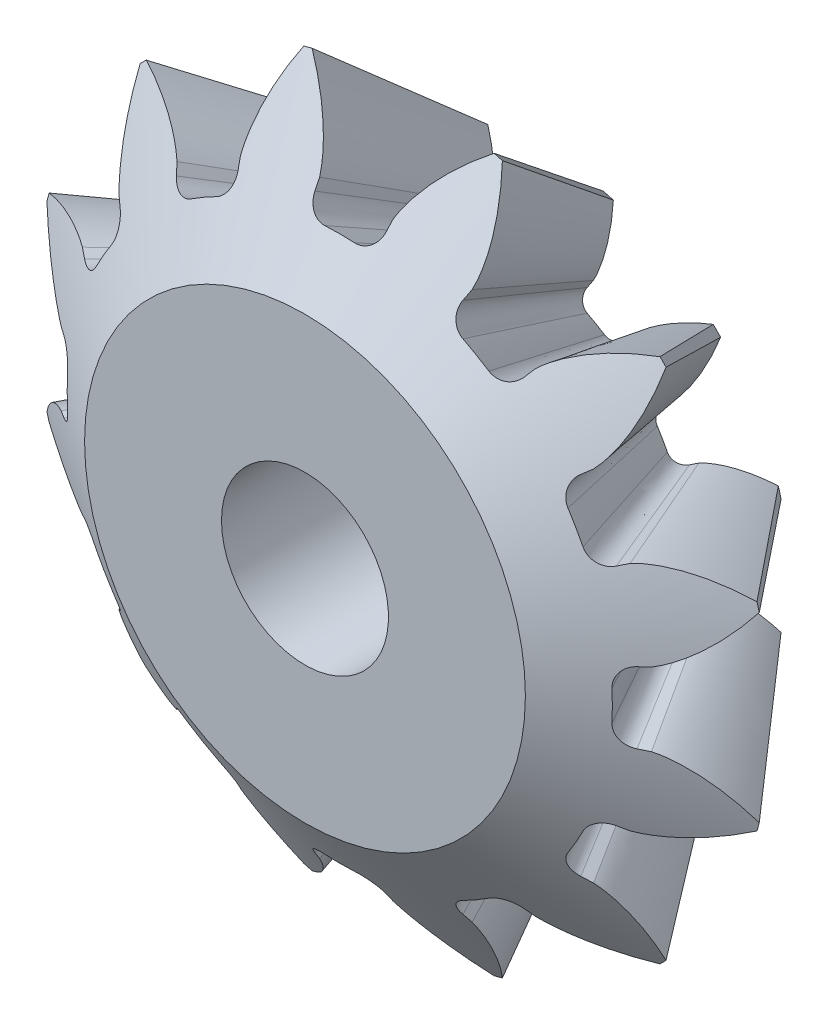
from build123d import *

# Parameters (mm, degrees)
TEETH_COUNT = 12


with BuildPart() as part:
    # Blank Sketch → Blank (revolve)
    with BuildSketch(Plane(origin=(0, 0, 0), x_dir=(1, 0, 0), z_dir=(0, 1, 0))):
        Polygon((6.213635009, -17.540922834), (11.620027042, -13.936661479), (17.611713424, -20.758857717), (10.560398314, -25.459734457), (4, -25.459734457), (4, -17.540922834), align=None)
    revolve(axis=Axis((0, 0, 0), (0, 0, 1)))

    # Heel Section Sketch for Tooth Space → Tooth Space section 0
    with BuildSketch(Plane(origin=(16.386750491, 0, 24.580125736), x_dir=(0.8320502943378437, 0, -0.5547001962252293), z_dir=(0.5547001962252291, 0, 0.8320502943378436))):
        with BuildLine():
            Line((-1.08891608, 1.922238136), (-1.634563238, 1.865864301))
            # circular arc as an exact rational Bezier (weights 1, cos(half-angle), 1)
            Bezier((-1.634563238, 1.865864301), (-2.609571063, 1.765130834), (-2.564644053, 0.785963304), weights=[1, 0.72700363, 1])
            Bezier((-2.564644053, 0.785963304), (-2.528581806, 0), (-2.564644053, -0.785963304), weights=[1, 0.998949041, 1])
            Bezier((-2.564644053, -0.785963304), (-2.609571063, -1.765130834), (-1.634563238, -1.865864301), weights=[1, 0.72700363, 1])
            Line((-1.634563238, -1.865864301), (-1.08891608, -1.922238136))
            add(Edge.make_bspline(
                [(-1.08891608, -1.922238136), (-1.058009299, -1.930081323), (-0.989704973, -1.948916589), (-0.846197794, -1.991766884), (-0.682273176, -2.051633091), (-0.464039363, -2.138079386), (-0.247151738, -2.238022431), (-0.004558905, -2.359571564), (0.226834524, -2.488356139), (0.457425198, -2.625947141), (0.681393703, -2.770305006), (0.921001726, -2.934382995), (1.208683296, -3.14547836), (1.54063082, -3.408550433), (1.911465124, -3.730523185), (2.29850424, -4.097681247), (2.670721891, -4.483299301), (3.025287202, -4.879693016), (3.367721609, -5.295465998), (3.689533802, -5.713062827), (4.005794089, -6.159094933), (4.254743772, -6.530395753), (4.48221166, -6.897435156), (4.663204857, -7.195659512), (4.830049786, -7.491940318), (4.914685936, -7.645183004), (4.971222232, -7.750335533)],
                knots=[0.016753246, 0.016753246, 0.016753246, 0.016753246, 0.016753246, 0.031570807, 0.050064154, 0.068907149, 0.096646347, 0.124385911, 0.152125765, 0.179865217, 0.207604696, 0.235344406, 0.263083989, 0.300343415, 0.355822558, 0.411301707, 0.466780802, 0.522259921, 0.577739134, 0.63321816, 0.688697367, 0.744176442, 0.799655597, 0.827395173, 0.855134749, 0.910613937, 0.910613937, 0.910613937, 0.910613937, 0.910613937], degree=4))
            Line((4.971222232, -7.750335533), (4.971222232, 7.750335533))
            add(Edge.make_bspline(
                [(-1.08891608, 1.922238136), (-1.058009299, 1.930081323), (-0.989704973, 1.948916589), (-0.846197794, 1.991766884), (-0.682273176, 2.051633091), (-0.464039363, 2.138079386), (-0.247151738, 2.238022431), (-0.004558905, 2.359571564), (0.226834524, 2.488356139), (0.457425198, 2.625947141), (0.681393703, 2.770305006), (0.921001726, 2.934382995), (1.208683296, 3.14547836), (1.54063082, 3.408550433), (1.911465124, 3.730523185), (2.29850424, 4.097681247), (2.670721891, 4.483299301), (3.025287202, 4.879693016), (3.367721609, 5.295465998), (3.689533802, 5.713062827), (4.005794089, 6.159094933), (4.254743772, 6.530395753), (4.48221166, 6.897435156), (4.663204857, 7.195659512), (4.830049786, 7.491940318), (4.914685936, 7.645183004), (4.971222232, 7.750335533)],
                knots=[0.016753246, 0.016753246, 0.016753246, 0.016753246, 0.016753246, 0.031570807, 0.050064154, 0.068907149, 0.096646347, 0.124385911, 0.152125765, 0.179865217, 0.207604696, 0.235344406, 0.263083989, 0.300343415, 0.355822558, 0.411301707, 0.466780802, 0.522259921, 0.577739134, 0.63321816, 0.688697367, 0.744176442, 0.799655597, 0.827395173, 0.855134749, 0.910613937, 0.910613937, 0.910613937, 0.910613937, 0.910613937], degree=4))
        make_face()
    # Toe Section Sketch for Tooth Space → Tooth Space section 1
    with BuildSketch(Plane(origin=(8.620947743, 0, 12.931421615), x_dir=(0.8320502943378437, 0, -0.5547001962252291), z_dir=(0.5547001962252291, 0, 0.8320502943378437))):
        with BuildLine():
            Line((-0.572870663, 1.011275209), (-0.859931581, 0.981617353))
            Bezier((-0.859931581, 0.981617353), (-1.372875957, 0.928622224), (-1.349240191, 0.413489457), weights=[1, 0.72700363, 1])
            Bezier((-1.349240191, 0.413489457), (-1.330268111, 0), (-1.349240191, -0.413489457), weights=[1, 0.998949041, 1])
            Bezier((-1.349240191, -0.413489457), (-1.372875957, -0.928622224), (-0.859931581, -0.981617353), weights=[1, 0.72700363, 1])
            Line((-0.859931581, -0.981617353), (-0.572870663, -1.011275209))
            add(Edge.make_bspline(
                [(-0.572870663, -1.011275209), (-0.556610835, -1.015401451), (-0.520676399, -1.025310615), (-0.445177509, -1.047855379), (-0.358940761, -1.079345382), (-0.244123892, -1.1248347), (-0.130031128, -1.177395014), (-0.002388511, -1.241371482), (0.119320096, -1.309076181), (0.2406736, -1.381538907), (0.358435912, -1.457362017), (0.48459778, -1.543879139), (0.635755376, -1.654582298), (0.81074842, -1.793648282), (1.005234225, -1.96190606), (1.209783259, -2.156796148), (1.404163841, -2.356987889), (1.593014603, -2.569836498), (1.769382258, -2.781532373), (1.944922511, -3.012828169), (2.100900922, -3.228131448), (2.268467849, -3.4846438), (2.396488156, -3.686613638), (2.526590622, -3.915286654), (2.585579774, -4.022074005), (2.615323099, -4.077393969)],
                knots=[0.016753246, 0.016753246, 0.016753246, 0.016753246, 0.016753246, 0.031570807, 0.050064154, 0.068907149, 0.096646347, 0.124385911, 0.152125765, 0.179865217, 0.207604696, 0.235344406, 0.263083989, 0.300343415, 0.355822558, 0.411301707, 0.466780802, 0.522259921, 0.577739134, 0.63321816, 0.688697367, 0.744176442, 0.799655597, 0.855134749, 0.910613937, 0.910613937, 0.910613937, 0.910613937, 0.910613937], degree=4))
            Line((2.615323099, -4.077393969), (2.615323099, 4.077393969))
            add(Edge.make_bspline(
                [(-0.572870663, 1.011275209), (-0.556610835, 1.015401451), (-0.520676399, 1.025310615), (-0.445177509, 1.047855379), (-0.358940761, 1.079345382), (-0.244123892, 1.1248347), (-0.130031128, 1.177395014), (-0.002388511, 1.241371482), (0.119320096, 1.309076181), (0.2406736, 1.381538907), (0.358435912, 1.457362017), (0.48459778, 1.543879139), (0.635755376, 1.654582298), (0.81074842, 1.793648282), (1.005234225, 1.96190606), (1.209783259, 2.156796148), (1.404163841, 2.356987889), (1.593014603, 2.569836498), (1.769382258, 2.781532373), (1.944922511, 3.012828169), (2.100900922, 3.228131448), (2.268467849, 3.4846438), (2.396488156, 3.686613638), (2.526590622, 3.915286654), (2.585579774, 4.022074005), (2.615323099, 4.077393969)],
                knots=[0.016753246, 0.016753246, 0.016753246, 0.016753246, 0.016753246, 0.031570807, 0.050064154, 0.068907149, 0.096646347, 0.124385911, 0.152125765, 0.179865217, 0.207604696, 0.235344406, 0.263083989, 0.300343415, 0.355822558, 0.411301707, 0.466780802, 0.522259921, 0.577739134, 0.63321816, 0.688697367, 0.744176442, 0.799655597, 0.855134749, 0.910613937, 0.910613937, 0.910613937, 0.910613937, 0.910613937], degree=4))
        make_face()
    tooth_space = loft(mode=Mode.SUBTRACT)

    # Teeth: Tooth Space ×12 about axis
    teeth_axis = Axis((0, 0, -1.352081728), (0, 0, 1))
    for i in range(1, TEETH_COUNT):
        add(tooth_space.rotate(teeth_axis, i * 360 / TEETH_COUNT), mode=Mode.SUBTRACT)


solid = part.part
